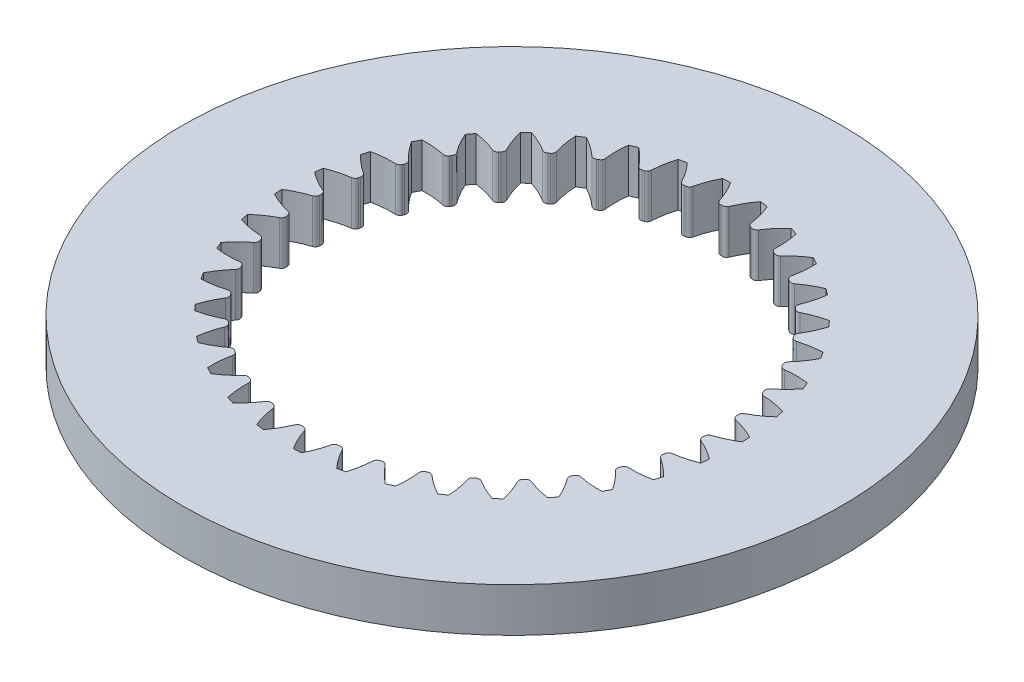
from build123d import *

# Parameters (mm, degrees)
SKETCH1_R            = 22.5
SKETCH1_R_2          = 13.7
BOSS_EXTRUDE1_DEPTH  = 3
CUT_EXTRUDE2_START   = -3
CUT_EXTRUDE2_DEPTH   = 3
FILLET1_R            = 0.3
FILLET1_OF_MIRROR2_R = 0.3
CIRPATTERN3_DEPTH    = 3


# Read off the part's stored shape, not the designer's step: CirPattern3
with BuildPart() as part:
    # Sketch1 → Boss-Extrude1 (new body)
    with BuildSketch(Plane(origin=(0, 0, 0), x_dir=(1, 0, 0), z_dir=(0, 1, 0))):
        with Locations(Location((0, 0, 0), (0, 0, 270))):
            Circle(SKETCH1_R)
        with Locations(Location((0, 0, 0), (0, 0, 270))):
            Circle(SKETCH1_R_2, mode=Mode.SUBTRACT)
    extrude(amount=BOSS_EXTRUDE1_DEPTH)

    # Sketch2 → Cut-Extrude2 (cut)
    with BuildSketch(Plane(origin=(0, 3, 0), x_dir=(1, 0, 0), z_dir=(0, 1, 0)).offset(CUT_EXTRUDE2_START)):
        with BuildLine():
            Line((-0.659315721, 15.310810814), (-0.589404592, 13.687315377))
            ThreePointArc((-0.589404592, 13.687315377), (-0.127341536, 13.699408167), (0.334866473, 13.69590685))
            ThreePointArc((0.334866473, 13.69590685), (0.029845286, 14.534501143), (-0.393663107, 15.319943027))
            ThreePointArc((-0.393663107, 15.319943027), (-0.526509214, 15.315952894), (-0.659315721, 15.310810814))
        make_face()
    cut_extrude2 = extrude(amount=CUT_EXTRUDE2_DEPTH, mode=Mode.SUBTRACT)

    # Fillet1
    fillet1_edges = [part.edges().sort_by_distance(p)[0] for p in [
        (0.334866473, 1.5, -13.69590685),
    ]]
    fillet(fillet1_edges, radius=FILLET1_R)

    # Mirror2: Cut-Extrude2 across plane
    add(cut_extrude2.mirror(Plane(origin=(0, 0, 0), x_dir=(0.0430222330045314, 0, 0.9990741151022299), z_dir=(0.9990741151022301, 0, -0.0430222330045314))), mode=Mode.SUBTRACT)

    # Fillet1 of Mirror2
    fillet1_of_mirror2_edges = [part.edges().sort_by_distance(p)[0] for p in [
        (-1.510992732, 1.5, -13.61642027),
    ]]
    fillet(fillet1_of_mirror2_edges, radius=FILLET1_OF_MIRROR2_R)

    # CirPattern3 outline → CirPattern3 (cut)
    with BuildSketch(Plane(origin=(0, 0, 0), x_dir=(1, 0, 0), z_dir=(0, 1, 0))):
        with BuildLine():
            ThreePointArc((-2.143283621, 13.733664561), (-2.554275932, 14.4053579), (-3.047962668, 15.018839788))
            ThreePointArc((-3.047962668, 15.018839788), (-3.30799363, 14.963716221), (-3.567029405, 14.904090923))
            ThreePointArc((-3.567029405, 14.904090923), (-3.756106834, 14.139671963), (-3.8456578, 13.357324696))
            ThreePointArc((-3.8456578, 13.357324696), (-3.908281233, 13.188307818), (-4.056459599, 13.085684373))
            ThreePointArc((-4.056459599, 13.085684373), (-2.957227584, 13.377025268), (-1.83762017, 13.576198))
            ThreePointArc((-1.83762017, 13.576198), (-2.015249468, 13.606795908), (-2.143283621, 13.733664561))
        make_face()
        with BuildLine():
            ThreePointArc((0.663742493, 13.683911937), (1.79632716, 13.581723335), (2.916535072, 13.385956192))
            ThreePointArc((2.916535072, 13.385956192), (2.760083233, 13.475461619), (2.683162119, 13.638469416))
            ThreePointArc((2.683162119, 13.638469416), (2.526688329, 14.410222339), (2.272597709, 15.15555755))
            ThreePointArc((2.272597709, 15.15555755), (2.009395163, 15.192694168), (1.745588104, 15.225260168))
            ThreePointArc((1.745588104, 15.225260168), (1.306466756, 14.571609602), (0.95473785, 13.867071883))
            ThreePointArc((0.95473785, 13.867071883), (0.838083895, 13.729666445), (0.663742493, 13.683911937))
        make_face()
        with BuildLine():
            ThreePointArc((3.029845124, 13.360764893), (4.127478421, 13.063457501), (5.19667325, 12.676142439))
            ThreePointArc((5.19667325, 12.676142439), (5.05814072, 12.791455655), (5.010694217, 12.965344208))
            ThreePointArc((5.010694217, 12.965344208), (4.990611105, 13.752543858), (4.869806794, 14.530678126))
            ThreePointArc((4.869806794, 14.530678126), (4.617051591, 14.612955197), (4.362907381, 14.690836062))
            ThreePointArc((4.362907381, 14.690836062), (3.816952044, 14.123368538), (3.348224999, 13.490611414))
            ThreePointArc((3.348224999, 13.490611414), (3.209483076, 13.37555022), (3.029845124, 13.360764893))
        make_face()
        with BuildLine():
            ThreePointArc((5.303887445, 12.631657768), (6.333218339, 12.148265122), (7.318913141, 11.581170512))
            ThreePointArc((7.318913141, 11.581170512), (7.202509161, 11.718787783), (7.185978908, 11.898273577))
            ThreePointArc((7.185978908, 11.898273577), (7.302896688, 12.677001291), (7.319049263, 13.464291399))
            ThreePointArc((7.319049263, 13.464291399), (7.084421244, 13.589208978), (6.847661925, 13.710038336))
            ThreePointArc((6.847661925, 13.710038336), (6.211461175, 13.245996068), (5.639978025, 12.704245544))
            ThreePointArc((5.639978025, 12.704245544), (5.483363737, 12.61502467), (5.303887445, 12.631657768))
        make_face()
        with BuildLine():
            ThreePointArc((7.416773829, 11.518744114), (8.346526622, 10.863953855), (9.218771559, 10.13431058))
            ThreePointArc((9.218771559, 10.13431058), (9.128033006, 10.290050474), (9.142921265, 10.469679924))
            ThreePointArc((9.142921265, 10.469679924), (9.39328745, 11.216274455), (9.545906124, 11.988798992))
            ThreePointArc((9.545906124, 11.988798992), (9.336534341, 12.15256152), (9.124353726, 12.312668032))
            ThreePointArc((9.124353726, 12.312668032), (8.417238201, 11.966150711), (7.760363174, 11.531867601))
            ThreePointArc((7.760363174, 11.531867601), (7.590635166, 11.471197979), (7.416773829, 11.518744114))
        make_face()
        with BuildLine():
            ThreePointArc((9.304305294, 10.055839249), (10.106229917, 9.249546846), (10.838522269, 8.379524749))
            ThreePointArc((10.838522269, 8.379524749), (10.776206187, 8.548655188), (10.822060587, 8.722970344))
            ThreePointArc((10.822060587, 8.722970344), (11.198267926, 9.414746795), (11.482715458, 10.149032994))
            ThreePointArc((11.482715458, 10.149032994), (11.304961567, 10.346664629), (11.123806657, 10.541183542))
            ThreePointArc((11.123806657, 10.541183542), (10.367261704, 10.322719919), (9.644953614, 10.009099698))
            ThreePointArc((9.644953614, 10.009099698), (9.467268987, 9.978824742), (9.304305294, 10.055839249))
        make_face()
        with BuildLine():
            ThreePointArc((10.90913015, 8.287392797), (11.55886053, 7.354097038), (12.128949964, 6.370131299))
            ThreePointArc((12.128949964, 6.370131299), (12.096949796, 6.547513341), (12.172377073, 6.711217725))
            ThreePointArc((12.172377073, 6.711217725), (12.662994698, 7.327156818), (13.070628293, 8.000893764))
            ThreePointArc((13.070628293, 8.000893764), (12.929893257, 8.22638957), (12.785268351, 8.449410523))
            ThreePointArc((12.785268351, 8.449410523), (12.002281206, 8.365638506), (11.236487019, 8.182210364))
            ThreePointArc((11.236487019, 8.182210364), (11.05624463, 8.183249965), (10.90913015, 8.287392797))
        make_face()
        with BuildLine():
            ThreePointArc((12.182486607, 6.267138108), (12.660281015, 5.235196713), (13.050845652, 4.167184633))
            ThreePointArc((13.050845652, 4.167184633), (13.050133707, 4.347428614), (13.152842042, 4.495548151))
            ThreePointArc((13.152842042, 4.495548151), (13.742962784, 5.016934889), (14.261396701, 5.609651426))
            ThreePointArc((14.261396701, 5.609651426), (14.161956683, 5.856159827), (14.058256136, 6.100906441))
            ThreePointArc((14.058256136, 6.100906441), (13.272617467, 6.1543714), (12.486605452, 6.106708709))
            ThreePointArc((12.486605452, 6.106708709), (12.309281875, 6.139031279), (12.182486607, 6.267138108))
        make_face()
        with BuildLine():
            ThreePointArc((13.085684373, 4.056459599), (13.377025267, 2.957227584), (13.576197999, 1.83762017))
            ThreePointArc((13.576197999, 1.83762017), (13.606795908, 2.015249468), (13.733664561, 2.143283621))
            ThreePointArc((13.733664561, 2.143283621), (14.4053579, 2.554275932), (15.018839788, 3.047962668))
            ThreePointArc((15.018839788, 3.047962668), (14.963716221, 3.30799363), (14.904090923, 3.567029405))
            ThreePointArc((14.904090923, 3.567029405), (14.139671963, 3.756106834), (13.357324696, 3.8456578))
            ThreePointArc((13.357324696, 3.8456578), (13.188307818, 3.908281233), (13.085684373, 4.056459599))
        make_face()
        with BuildLine():
            ThreePointArc((13.591280241, 1.722527618), (13.687315376, 0.589404592), (13.689044439, -0.547779452))
            ThreePointArc((13.689044439, -0.547779452), (13.750022502, -0.378162013), (13.897196632, -0.274103497))
            ThreePointArc((13.897196632, -0.274103497), (14.630053505, 0.014006593), (15.319943027, 0.393663107))
            ThreePointArc((15.319943027, 0.393663107), (15.310810814, 0.659315721), (15.297072448, 0.924769984))
            ThreePointArc((15.297072448, 0.924769984), (14.577099681, 1.243714862), (13.82218839, 1.467758525))
            ThreePointArc((13.82218839, 1.467758525), (13.666613703, 1.55878004), (13.591280241, 1.722527618))
        make_face()
        with BuildLine():
            ThreePointArc((13.683911937, -0.663742493), (13.581723334, -1.79632716), (13.385956192, -2.916535072))
            ThreePointArc((13.385956192, -2.916535072), (13.475461619, -2.760083233), (13.638469416, -2.683162119))
            ThreePointArc((13.638469416, -2.683162119), (14.410222339, -2.526688329), (15.15555755, -2.272597709))
            ThreePointArc((15.15555755, -2.272597709), (15.192694168, -2.009395163), (15.225260168, -1.745588104))
            ThreePointArc((15.225260168, -1.745588104), (14.571609602, -1.306466756), (13.867071883, -0.95473785))
            ThreePointArc((13.867071883, -0.95473785), (13.729666445, -0.838083895), (13.683911937, -0.663742493))
        make_face()
        with BuildLine():
            ThreePointArc((13.360764893, -3.029845124), (13.063457501, -4.127478421), (12.676142439, -5.19667325))
            ThreePointArc((12.676142439, -5.19667325), (12.791455655, -5.05814072), (12.965344208, -5.010694217))
            ThreePointArc((12.965344208, -5.010694217), (13.752543858, -4.990611105), (14.530678126, -4.869806794))
            ThreePointArc((14.530678126, -4.869806794), (14.612955197, -4.617051591), (14.690836062, -4.362907381))
            ThreePointArc((14.690836062, -4.362907381), (14.123368538, -3.816952044), (13.490611414, -3.348224999))
            ThreePointArc((13.490611414, -3.348224999), (13.37555022, -3.209483076), (13.360764893, -3.029845124))
        make_face()
        with BuildLine():
            ThreePointArc((12.631657768, -5.303887445), (12.148265122, -6.333218338), (11.581170512, -7.31891314))
            ThreePointArc((11.581170512, -7.31891314), (11.718787783, -7.202509161), (11.898273577, -7.185978908))
            ThreePointArc((11.898273577, -7.185978908), (12.677001291, -7.302896688), (13.464291399, -7.319049263))
            ThreePointArc((13.464291399, -7.319049263), (13.589208978, -7.084421244), (13.710038336, -6.847661925))
            ThreePointArc((13.710038336, -6.847661925), (13.245996068, -6.211461175), (12.704245544, -5.639978025))
            ThreePointArc((12.704245544, -5.639978025), (12.61502467, -5.483363737), (12.631657768, -5.303887445))
        make_face()
        with BuildLine():
            ThreePointArc((11.518744114, -7.416773829), (10.863953854, -8.346526621), (10.13431058, -9.218771559))
            ThreePointArc((10.13431058, -9.218771559), (10.290050474, -9.128033006), (10.469679924, -9.142921265))
            ThreePointArc((10.469679924, -9.142921265), (11.216274455, -9.39328745), (11.988798992, -9.545906124))
            ThreePointArc((11.988798992, -9.545906124), (12.15256152, -9.336534341), (12.312668032, -9.124353726))
            ThreePointArc((12.312668032, -9.124353726), (11.966150711, -8.417238201), (11.531867601, -7.760363174))
            ThreePointArc((11.531867601, -7.760363174), (11.471197979, -7.590635166), (11.518744114, -7.416773829))
        make_face()
        with BuildLine():
            ThreePointArc((10.055839249, -9.304305294), (9.249546846, -10.106229917), (8.379524749, -10.838522269))
            ThreePointArc((8.379524749, -10.838522269), (8.548655188, -10.776206187), (8.722970344, -10.822060587))
            ThreePointArc((8.722970344, -10.822060587), (9.414746795, -11.198267926), (10.149032994, -11.482715458))
            ThreePointArc((10.149032994, -11.482715458), (10.346664629, -11.304961567), (10.541183542, -11.123806657))
            ThreePointArc((10.541183542, -11.123806657), (10.322719919, -10.367261704), (10.009099698, -9.644953614))
            ThreePointArc((10.009099698, -9.644953614), (9.978824742, -9.467268987), (10.055839249, -9.304305294))
        make_face()
        with BuildLine():
            ThreePointArc((8.287392797, -10.90913015), (7.354097038, -11.55886053), (6.370131299, -12.128949964))
            ThreePointArc((6.370131299, -12.128949964), (6.547513341, -12.096949796), (6.711217725, -12.172377073))
            ThreePointArc((6.711217725, -12.172377073), (7.327156818, -12.662994698), (8.000893764, -13.070628293))
            ThreePointArc((8.000893764, -13.070628293), (8.22638957, -12.929893257), (8.449410523, -12.785268351))
            ThreePointArc((8.449410523, -12.785268351), (8.365638506, -12.002281206), (8.182210364, -11.236487019))
            ThreePointArc((8.182210364, -11.236487019), (8.183249965, -11.05624463), (8.287392797, -10.90913015))
        make_face()
        with BuildLine():
            ThreePointArc((6.267138108, -12.182486607), (5.235196713, -12.660281015), (4.167184633, -13.050845652))
            ThreePointArc((4.167184633, -13.050845652), (4.347428614, -13.050133707), (4.495548151, -13.152842042))
            ThreePointArc((4.495548151, -13.152842042), (5.016934889, -13.742962784), (5.609651426, -14.261396701))
            ThreePointArc((5.609651426, -14.261396701), (5.856159827, -14.161956683), (6.100906441, -14.058256136))
            ThreePointArc((6.100906441, -14.058256136), (6.1543714, -13.272617467), (6.106708709, -12.486605452))
            ThreePointArc((6.106708709, -12.486605452), (6.139031279, -12.309281875), (6.267138108, -12.182486607))
        make_face()
        with BuildLine():
            ThreePointArc((4.056459599, -13.085684373), (2.957227584, -13.377025268), (1.83762017, -13.576197999))
            ThreePointArc((1.83762017, -13.576197999), (2.015249468, -13.606795908), (2.143283621, -13.733664561))
            ThreePointArc((2.143283621, -13.733664561), (2.554275932, -14.4053579), (3.047962668, -15.018839788))
            ThreePointArc((3.047962668, -15.018839788), (3.30799363, -14.963716221), (3.567029405, -14.904090923))
            ThreePointArc((3.567029405, -14.904090923), (3.756106834, -14.139671963), (3.8456578, -13.357324696))
            ThreePointArc((3.8456578, -13.357324696), (3.908281233, -13.188307818), (4.056459599, -13.085684373))
        make_face()
        with BuildLine():
            ThreePointArc((1.722527618, -13.591280242), (0.589404592, -13.687315377), (-0.547779452, -13.68904444))
            ThreePointArc((-0.547779452, -13.68904444), (-0.378162013, -13.750022502), (-0.274103497, -13.897196632))
            ThreePointArc((-0.274103497, -13.897196632), (0.014006593, -14.630053505), (0.393663107, -15.319943027))
            ThreePointArc((0.393663107, -15.319943027), (0.659315721, -15.310810814), (0.924769984, -15.297072448))
            ThreePointArc((0.924769984, -15.297072448), (1.243714862, -14.577099681), (1.467758525, -13.82218839))
            ThreePointArc((1.467758525, -13.82218839), (1.55878004, -13.666613703), (1.722527618, -13.591280242))
        make_face()
        with BuildLine():
            ThreePointArc((-0.663742493, -13.683911937), (-1.79632716, -13.581723335), (-2.916535072, -13.385956192))
            ThreePointArc((-2.916535072, -13.385956192), (-2.760083233, -13.475461619), (-2.683162119, -13.638469416))
            ThreePointArc((-2.683162119, -13.638469416), (-2.526688329, -14.410222339), (-2.272597709, -15.15555755))
            ThreePointArc((-2.272597709, -15.15555755), (-2.009395163, -15.192694168), (-1.745588104, -15.225260168))
            ThreePointArc((-1.745588104, -15.225260168), (-1.306466756, -14.571609602), (-0.95473785, -13.867071883))
            ThreePointArc((-0.95473785, -13.867071883), (-0.838083895, -13.729666445), (-0.663742493, -13.683911937))
        make_face()
        with BuildLine():
            ThreePointArc((-3.029845124, -13.360764893), (-4.127478421, -13.063457501), (-5.19667325, -12.676142439))
            ThreePointArc((-5.19667325, -12.676142439), (-5.05814072, -12.791455655), (-5.010694217, -12.965344208))
            ThreePointArc((-5.010694217, -12.965344208), (-4.990611105, -13.752543858), (-4.869806794, -14.530678126))
            ThreePointArc((-4.869806794, -14.530678126), (-4.617051591, -14.612955197), (-4.362907381, -14.690836062))
            ThreePointArc((-4.362907381, -14.690836062), (-3.816952044, -14.123368538), (-3.348224999, -13.490611414))
            ThreePointArc((-3.348224999, -13.490611414), (-3.209483076, -13.37555022), (-3.029845124, -13.360764893))
        make_face()
        with BuildLine():
            ThreePointArc((-5.303887445, -12.631657768), (-6.333218339, -12.148265122), (-7.318913141, -11.581170513))
            ThreePointArc((-7.318913141, -11.581170513), (-7.202509161, -11.718787783), (-7.185978908, -11.898273577))
            ThreePointArc((-7.185978908, -11.898273577), (-7.302896688, -12.677001291), (-7.319049263, -13.464291399))
            ThreePointArc((-7.319049263, -13.464291399), (-7.084421244, -13.589208978), (-6.847661925, -13.710038336))
            ThreePointArc((-6.847661925, -13.710038336), (-6.211461175, -13.245996068), (-5.639978025, -12.704245544))
            ThreePointArc((-5.639978025, -12.704245544), (-5.483363737, -12.61502467), (-5.303887445, -12.631657768))
        make_face()
        with BuildLine():
            ThreePointArc((-7.416773829, -11.518744115), (-8.346526622, -10.863953855), (-9.21877156, -10.134310581))
            ThreePointArc((-9.21877156, -10.134310581), (-9.128033006, -10.290050474), (-9.142921265, -10.469679924))
            ThreePointArc((-9.142921265, -10.469679924), (-9.39328745, -11.216274455), (-9.545906124, -11.988798992))
            ThreePointArc((-9.545906124, -11.988798992), (-9.336534341, -12.15256152), (-9.124353726, -12.312668032))
            ThreePointArc((-9.124353726, -12.312668032), (-8.417238201, -11.966150711), (-7.760363174, -11.531867601))
            ThreePointArc((-7.760363174, -11.531867601), (-7.590635166, -11.471197979), (-7.416773829, -11.518744115))
        make_face()
        with BuildLine():
            ThreePointArc((-9.304305294, -10.055839249), (-10.106229917, -9.249546847), (-10.83852227, -8.37952475))
            ThreePointArc((-10.83852227, -8.37952475), (-10.776206187, -8.548655188), (-10.822060587, -8.722970344))
            ThreePointArc((-10.822060587, -8.722970344), (-11.198267926, -9.414746795), (-11.482715458, -10.149032994))
            ThreePointArc((-11.482715458, -10.149032994), (-11.304961567, -10.346664629), (-11.123806657, -10.541183542))
            ThreePointArc((-11.123806657, -10.541183542), (-10.367261704, -10.322719919), (-9.644953614, -10.009099698))
            ThreePointArc((-9.644953614, -10.009099698), (-9.467268987, -9.978824742), (-9.304305294, -10.055839249))
        make_face()
        with BuildLine():
            ThreePointArc((-10.909130151, -8.287392797), (-11.55886053, -7.354097039), (-12.128949965, -6.370131299))
            ThreePointArc((-12.128949965, -6.370131299), (-12.096949796, -6.547513341), (-12.172377073, -6.711217725))
            ThreePointArc((-12.172377073, -6.711217725), (-12.662994698, -7.327156818), (-13.070628293, -8.000893764))
            ThreePointArc((-13.070628293, -8.000893764), (-12.929893257, -8.22638957), (-12.785268351, -8.449410523))
            ThreePointArc((-12.785268351, -8.449410523), (-12.002281206, -8.365638506), (-11.236487019, -8.182210364))
            ThreePointArc((-11.236487019, -8.182210364), (-11.05624463, -8.183249965), (-10.909130151, -8.287392797))
        make_face()
        with BuildLine():
            ThreePointArc((-12.182486608, -6.267138108), (-12.660281016, -5.235196713), (-13.050845653, -4.167184633))
            ThreePointArc((-13.050845653, -4.167184633), (-13.050133707, -4.347428614), (-13.152842042, -4.495548151))
            ThreePointArc((-13.152842042, -4.495548151), (-13.742962784, -5.016934889), (-14.261396701, -5.609651426))
            ThreePointArc((-14.261396701, -5.609651426), (-14.161956683, -5.856159827), (-14.058256136, -6.100906441))
            ThreePointArc((-14.058256136, -6.100906441), (-13.272617467, -6.1543714), (-12.486605452, -6.106708709))
            ThreePointArc((-12.486605452, -6.106708709), (-12.309281875, -6.139031279), (-12.182486608, -6.267138108))
        make_face()
        with BuildLine():
            ThreePointArc((-13.085684374, -4.056459599), (-13.377025269, -2.957227585), (-13.576198, -1.83762017))
            ThreePointArc((-13.576198, -1.83762017), (-13.606795908, -2.015249468), (-13.733664561, -2.143283621))
            ThreePointArc((-13.733664561, -2.143283621), (-14.4053579, -2.554275932), (-15.018839788, -3.047962668))
            ThreePointArc((-15.018839788, -3.047962668), (-14.963716221, -3.30799363), (-14.904090923, -3.567029405))
            ThreePointArc((-14.904090923, -3.567029405), (-14.139671963, -3.756106834), (-13.357324696, -3.8456578))
            ThreePointArc((-13.357324696, -3.8456578), (-13.188307818, -3.908281233), (-13.085684374, -4.056459599))
        make_face()
        with BuildLine():
            ThreePointArc((-13.591280242, -1.722527618), (-13.687315378, -0.589404592), (-13.689044441, 0.547779452))
            ThreePointArc((-13.689044441, 0.547779452), (-13.750022502, 0.378162013), (-13.897196632, 0.274103497))
            ThreePointArc((-13.897196632, 0.274103497), (-14.630053505, -0.014006593), (-15.319943027, -0.393663107))
            ThreePointArc((-15.319943027, -0.393663107), (-15.310810814, -0.659315721), (-15.297072448, -0.924769984))
            ThreePointArc((-15.297072448, -0.924769984), (-14.577099681, -1.243714862), (-13.82218839, -1.467758525))
            ThreePointArc((-13.82218839, -1.467758525), (-13.666613703, -1.55878004), (-13.591280242, -1.722527618))
        make_face()
        with BuildLine():
            ThreePointArc((-13.683911938, 0.663742493), (-13.581723335, 1.796327161), (-13.385956193, 2.916535072))
            ThreePointArc((-13.385956193, 2.916535072), (-13.475461619, 2.760083233), (-13.638469416, 2.683162119))
            ThreePointArc((-13.638469416, 2.683162119), (-14.410222339, 2.526688329), (-15.15555755, 2.272597709))
            ThreePointArc((-15.15555755, 2.272597709), (-15.192694168, 2.009395163), (-15.225260168, 1.745588104))
            ThreePointArc((-15.225260168, 1.745588104), (-14.571609602, 1.306466756), (-13.867071883, 0.95473785))
            ThreePointArc((-13.867071883, 0.95473785), (-13.729666445, 0.838083895), (-13.683911938, 0.663742493))
        make_face()
        with BuildLine():
            ThreePointArc((-13.360764894, 3.029845124), (-13.063457502, 4.127478421), (-12.67614244, 5.19667325))
            ThreePointArc((-12.67614244, 5.19667325), (-12.791455655, 5.05814072), (-12.965344208, 5.010694217))
            ThreePointArc((-12.965344208, 5.010694217), (-13.752543858, 4.990611105), (-14.530678126, 4.869806794))
            ThreePointArc((-14.530678126, 4.869806794), (-14.612955197, 4.617051591), (-14.690836062, 4.362907381))
            ThreePointArc((-14.690836062, 4.362907381), (-14.123368538, 3.816952044), (-13.490611414, 3.348224999))
            ThreePointArc((-13.490611414, 3.348224999), (-13.37555022, 3.209483076), (-13.360764894, 3.029845124))
        make_face()
        with BuildLine():
            ThreePointArc((-12.631657769, 5.303887445), (-12.148265123, 6.333218339), (-11.581170513, 7.318913141))
            ThreePointArc((-11.581170513, 7.318913141), (-11.718787783, 7.202509161), (-11.898273577, 7.185978908))
            ThreePointArc((-11.898273577, 7.185978908), (-12.677001291, 7.302896688), (-13.464291399, 7.319049263))
            ThreePointArc((-13.464291399, 7.319049263), (-13.589208978, 7.084421244), (-13.710038336, 6.847661925))
            ThreePointArc((-13.710038336, 6.847661925), (-13.245996068, 6.211461175), (-12.704245544, 5.639978025))
            ThreePointArc((-12.704245544, 5.639978025), (-12.61502467, 5.483363737), (-12.631657769, 5.303887445))
        make_face()
        with BuildLine():
            ThreePointArc((-11.518744115, 7.41677383), (-10.863953855, 8.346526622), (-10.134310581, 9.21877156))
            ThreePointArc((-10.134310581, 9.21877156), (-10.290050474, 9.128033006), (-10.469679924, 9.142921265))
            ThreePointArc((-10.469679924, 9.142921265), (-11.216274455, 9.39328745), (-11.988798992, 9.545906124))
            ThreePointArc((-11.988798992, 9.545906124), (-12.15256152, 9.336534341), (-12.312668032, 9.124353726))
            ThreePointArc((-12.312668032, 9.124353726), (-11.966150711, 8.417238201), (-11.531867601, 7.760363174))
            ThreePointArc((-11.531867601, 7.760363174), (-11.471197979, 7.590635166), (-11.518744115, 7.41677383))
        make_face()
        with BuildLine():
            ThreePointArc((-10.055839249, 9.304305294), (-9.249546847, 10.106229917), (-8.37952475, 10.83852227))
            ThreePointArc((-8.37952475, 10.83852227), (-8.548655188, 10.776206187), (-8.722970344, 10.822060587))
            ThreePointArc((-8.722970344, 10.822060587), (-9.414746795, 11.198267926), (-10.149032994, 11.482715458))
            ThreePointArc((-10.149032994, 11.482715458), (-10.346664629, 11.304961567), (-10.541183542, 11.123806657))
            ThreePointArc((-10.541183542, 11.123806657), (-10.322719919, 10.367261704), (-10.009099698, 9.644953614))
            ThreePointArc((-10.009099698, 9.644953614), (-9.978824742, 9.467268987), (-10.055839249, 9.304305294))
        make_face()
        with BuildLine():
            ThreePointArc((-8.287392797, 10.909130151), (-7.354097039, 11.55886053), (-6.370131299, 12.128949965))
            ThreePointArc((-6.370131299, 12.128949965), (-6.547513341, 12.096949796), (-6.711217725, 12.172377073))
            ThreePointArc((-6.711217725, 12.172377073), (-7.327156818, 12.662994698), (-8.000893764, 13.070628293))
            ThreePointArc((-8.000893764, 13.070628293), (-8.22638957, 12.929893257), (-8.449410523, 12.785268351))
            ThreePointArc((-8.449410523, 12.785268351), (-8.365638506, 12.002281206), (-8.182210364, 11.236487019))
            ThreePointArc((-8.182210364, 11.236487019), (-8.183249965, 11.05624463), (-8.287392797, 10.909130151))
        make_face()
        with BuildLine():
            ThreePointArc((-6.267138108, 12.182486608), (-5.235196713, 12.660281015), (-4.167184633, 13.050845653))
            ThreePointArc((-4.167184633, 13.050845653), (-4.347428614, 13.050133707), (-4.495548151, 13.152842042))
            ThreePointArc((-4.495548151, 13.152842042), (-5.016934889, 13.742962784), (-5.609651426, 14.261396701))
            ThreePointArc((-5.609651426, 14.261396701), (-5.856159827, 14.161956683), (-6.100906441, 14.058256136))
            ThreePointArc((-6.100906441, 14.058256136), (-6.1543714, 13.272617467), (-6.106708709, 12.486605452))
            ThreePointArc((-6.106708709, 12.486605452), (-6.139031279, 12.309281875), (-6.267138108, 12.182486608))
        make_face()
    extrude(amount=CIRPATTERN3_DEPTH, mode=Mode.SUBTRACT)


solid = part.part
